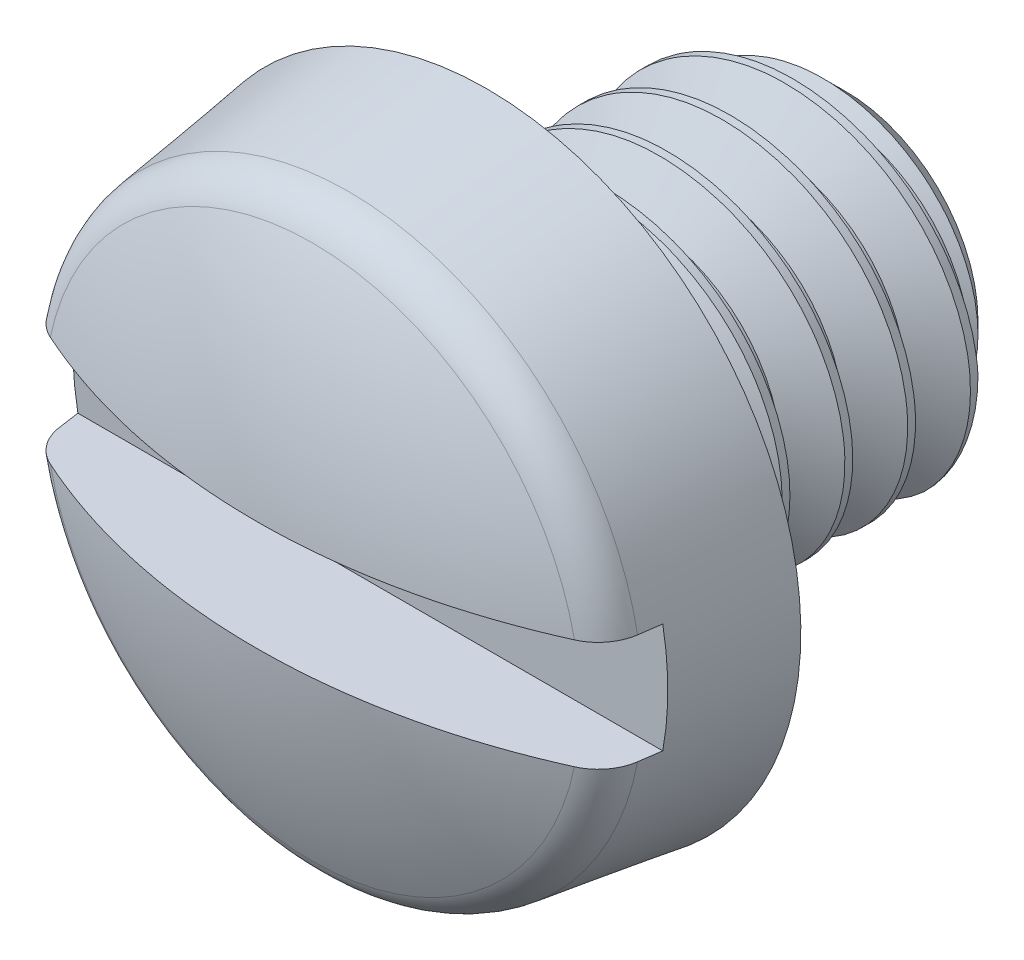
from build123d import *

# Parameters (mm, degrees)
SKETCH1_R        = 3.5
EXTRUDE3_DEPTH   = 2.6
SKETCH4_W        = 4
SKETCH4_H        = 2
CHAMFER1_SIZE    = 0.525
CUT_SWEEP1_PITCH = 0.7
CUT_SWEEP1_TO    = 4
SKETCH32_W       = 7
SKETCH32_H       = 1.225
EXTRUDE16_DEPTH  = 1.3


with BuildPart() as part:
    # Sketch1 → Extrude3 (new body)
    with BuildSketch(Plane.XY):
        Circle(SKETCH1_R)
    extrude(amount=EXTRUDE3_DEPTH)

    # Sketch11 → Cut-Revolve3 (revolve, cut)
    with BuildSketch(Plane(origin=(0, 0, 0), x_dir=(0, 0, -1), z_dir=(1, 0, 0))):
        with BuildLine():
            Line((-2.854, 3.64), (0, 3.64))
            Line((0, 3.64), (0, 3.5))
            Line((0, 3.5), (-1.545651878, 3.282772795))
            ThreePointArc((-1.545651878, 3.282772795), (-1.783581991, 3.185102895), (-1.945600864, 2.985352969))
            ThreePointArc((-1.945600864, 2.985352969), (-2.434480814, 1.528117353), (-2.6, 0))
            Line((-2.6, 0), (-2.854, 0))
            Line((-2.854, 0), (-2.854, 3.64))
        make_face()
    revolve(axis=Axis((0, 0, 0), (0, 0, 1)), mode=Mode.SUBTRACT)

    # Sketch32 → Extrude16 (cut)
    with BuildSketch(Plane.XY.offset(2.6)):
        Rectangle(SKETCH32_W, SKETCH32_H)
    extrude(amount=-EXTRUDE16_DEPTH, mode=Mode.SUBTRACT)


with BuildPart() as body_2:
    # Sketch4 → Revolve1 (revolve)
    with BuildSketch(Plane(origin=(0, 0, 0), x_dir=(0, 0, -1), z_dir=(1, 0, 0)), mode=Mode.PRIVATE) as revolve1_sk:
        with Locations((2, 1)):
            Rectangle(SKETCH4_W, SKETCH4_H)
    revolve(revolve1_sk.sketch.rotate(Axis((0, 0, 0), (0, 0, -1)), 90), axis=Axis((0, 0, 0), (0, 0, -1)))

    # Chamfer1
    chamfer1_edges = [body_2.edges().sort_by_distance(p)[0] for p in [
        (-2, 0, -4),
    ]]
    chamfer(chamfer1_edges, length=CHAMFER1_SIZE)

    # Cut-Sweep1: arcs per turn and ends read off the stored shape
    # Cut-Sweep1: the profile of Sketch14 profile screwed along a right-hand helix through 6.666667 turns, 6 arcs to a turn; built about Z, then put on its axis
    cut_sweep1_z = Axis((0, 0, 0), (0, 0, 1))
    cut_sweep1_corners = [(2.0003, 0, 0.000173205), (2.0003, 0, -0.612673205), (1.545336663, 0, -0.35), (1.545336663, 0, -0.2625)]
    with BuildLine(mode=Mode.PRIVATE) as cut_sweep1_profile:
        Line(cut_sweep1_corners[0], cut_sweep1_corners[1])
        Line(cut_sweep1_corners[1], cut_sweep1_corners[2])
        Line(cut_sweep1_corners[2], cut_sweep1_corners[3])
        Line(cut_sweep1_corners[3], cut_sweep1_corners[0])
    cut_sweep1_cap = Face(cut_sweep1_profile.wire())
    cut_sweep1_turn_angles = [0, 30, 60, 90, 120, 150, 180, 210, 240, 270, 300, 330, 360]
    cut_sweep1_turn_weights = [1, 0.8660254037844387, 1, 0.8660254037844387, 1, 0.8660254037844387, 1, 0.8660254037844387, 1, 0.8660254037844387, 1, 0.8660254037844387, 1]
    cut_sweep1_turn_rails = [Edge.make_bspline([Vector(p[0], p[1], 0).rotate(cut_sweep1_z, cut_sweep1_turn_angles[k]) / cut_sweep1_turn_weights[k] + Vector(0, 0, p[2] + CUT_SWEEP1_PITCH * cut_sweep1_turn_angles[k] / 360) for k in range(13)], [0, 0, 0, 1, 1, 2, 2, 3, 3, 4, 4, 5, 5, 6, 6, 6], 2, cut_sweep1_turn_weights) for p in cut_sweep1_corners]
    cut_sweep1_turn_sides = [Face.make_surface_from_curves(cut_sweep1_turn_rails[p[0]], cut_sweep1_turn_rails[p[1]]) for p in [(0, 1), (1, 2), (2, 3), (3, 0)]]
    cut_sweep1_last_angles = [2160, 2190, 2220, 2250, 2280, 2310, 2340, 2370, 2400]
    cut_sweep1_last_weights = [1, 0.8660254037844387, 1, 0.8660254037844387, 1, 0.8660254037844387, 1, 0.8660254037844387, 1]
    cut_sweep1_last_rails = [Edge.make_bspline([Vector(p[0], p[1], 0).rotate(cut_sweep1_z, cut_sweep1_last_angles[k]) / cut_sweep1_last_weights[k] + Vector(0, 0, p[2] + CUT_SWEEP1_PITCH * cut_sweep1_last_angles[k] / 360) for k in range(9)], [0, 0, 0, 1, 1, 2, 2, 3, 3, 4, 4, 4], 2, cut_sweep1_last_weights) for p in cut_sweep1_corners]
    cut_sweep1_last_sides = [Face.make_surface_from_curves(cut_sweep1_last_rails[p[0]], cut_sweep1_last_rails[p[1]]) for p in [(0, 1), (1, 2), (2, 3), (3, 0)]]
    cut_sweep1 = Plane(origin=(0, 0, -4), x_dir=(0, 1, 0), z_dir=(0, 0, 1)) * split(Solid(Shell([*[p.moved(Location((0, 0, CUT_SWEEP1_PITCH * i))) for i in range(6) for p in cut_sweep1_turn_sides], *cut_sweep1_last_sides, cut_sweep1_cap, cut_sweep1_cap.rotate(cut_sweep1_z, 2400).moved(Location((0, 0, CUT_SWEEP1_PITCH * 2400 / 360)))])), bisect_by=Plane.XY.offset(CUT_SWEEP1_TO), keep=Keep.BOTTOM, mode=Mode.PRIVATE)
    add(cut_sweep1, mode=Mode.SUBTRACT)


solid = Compound([part.part, body_2.part])
